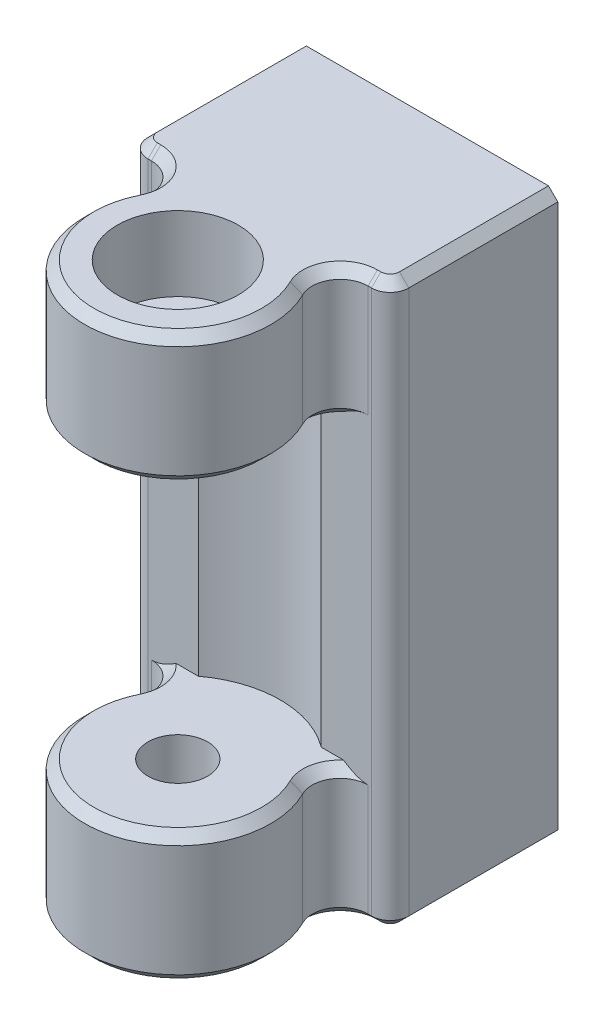
from build123d import *

# Parameters (mm, degrees)
CROQUIS2_R                 = 1.6
SALIENTE_EXTRUIR1_DEPTH    = 15.1
CORTAR_EXTRUIR4_DEPTH      = 8.1
CORTAR_EXTRUIR2_DEPTH      = 37.049965326
CORTAR_EXTRUIR2_DEPTH_BACK = 4
CROQUIS4_R                 = 3.25
CORTAR_EXTRUIR3_DEPTH      = 4
REDONDEO2_R                = 1
CHAFL_N1_SIZE              = 0.5


with BuildPart() as part:
    # Croquis2 → Saliente-Extruir1 (new, symmetric)
    with BuildSketch(Plane(origin=(0, 0, 0), x_dir=(0, 0, -1), z_dir=(0, 1, 0))):
        with BuildLine():
            Line((0, -7), (0, 7))
            Line((0, 7), (-9, 7))
            Line((-9, 7), (-9, 5.817215829))
            ThreePointArc((-9, 5.817215829), (-9.710647783, 4.541706881), (-11.169230769, 4.474781407))
            ThreePointArc((-11.169230769, 4.474781407), (-18.4, 0), (-11.169230769, -4.474781407))
            ThreePointArc((-11.169230769, -4.474781407), (-9.710647783, -4.541706881), (-9, -5.817215829))
            Line((-9, -5.817215829), (-9, -7))
            Line((-9, -7), (0, -7))
        make_face()
        with Locations((-13.4, 0)):
            Circle(CROQUIS2_R, mode=Mode.SUBTRACT)
    extrude(amount=SALIENTE_EXTRUIR1_DEPTH, both=True)

    # Croquis6 → Cortar-Extruir4 (cut, symmetric)
    with BuildSketch(Plane(origin=(0, 0, 0), x_dir=(1, 0, 0), z_dir=(0, 1, 0))):
        with BuildLine():
            Line((-7, -9), (-3.3, -9))
            ThreePointArc((-3.3, -9), (0, -7.9), (3.3, -9))
            Line((3.3, -9), (7, -9))
            Line((7, -9), (7, -18.9))
            Line((7, -18.9), (-7, -18.9))
            Line((-7, -18.9), (-7, -9))
        make_face()
    extrude(amount=CORTAR_EXTRUIR4_DEPTH, both=True, mode=Mode.SUBTRACT)

    # Croquis4 → Cortar-Extruir2 (cut, two sides: drawn at the far end of the back side and taken through both)
    with BuildSketch(Plane(origin=(0, 15.1, 0), x_dir=(1, 0, 0), z_dir=(0, 1, 0)).offset(-CORTAR_EXTRUIR2_DEPTH_BACK)):
        with Locations((0, -13.4)):
            Circle(CROQUIS4_R)
    extrude(amount=CORTAR_EXTRUIR2_DEPTH + CORTAR_EXTRUIR2_DEPTH_BACK, mode=Mode.SUBTRACT)

    # Croquis5 → Cortar-Extruir3 (cut)
    with BuildSketch(Plane.XZ.offset(15.1)):
        Polygon((1.5011107, 10.8), (3.0022214, 13.4), (1.5011107, 16), (-1.5011107, 16), (-3.0022214, 13.4), (-1.5011107, 10.8), align=None)
    extrude(amount=-CORTAR_EXTRUIR3_DEPTH, mode=Mode.SUBTRACT)

    # Redondeo2
    redondeo2_edges = [part.edges().sort_by_distance(p)[0] for p in [
        (-7, 0, 9),
        (7, 0, 9),
    ]]
    fillet(redondeo2_edges, radius=REDONDEO2_R)

    # Chaflán1
    chafl_n1_edges = [part.edges().sort_by_distance(p)[0] for p in [
        (7, -15.1, 4),
        (6.707106781, -15.1, 8.707106781),
        (5.908607914, -15.1, 9),
        (-7, -15.1, 4),
        (4.541706881, -15.1, 9.710647783),
        (-6.707106781, -15.1, 8.707106781),
        (0, -15.1, 18.4),
        (-5.908607914, -15.1, 9),
        (-4.541706881, -15.1, 9.710647783),
    ]]
    chamfer(chafl_n1_edges, length=CHAFL_N1_SIZE)
    chafl_n1_2_edges = [part.edges().sort_by_distance(p)[0] for p in [
        (7, 15.1, 4),
        (6.707106781, 15.1, 8.707106781),
        (5.908607914, 15.1, 9),
        (-7, 15.1, 4),
        (-6.707106781, 15.1, 8.707106781),
        (-5.908607914, 15.1, 9),
        (4.541706881, 15.1, 9.710647783),
        (0, 15.1, 18.4),
        (-4.541706881, 15.1, 9.710647783),
    ]]
    chamfer(chafl_n1_2_edges, length=CHAFL_N1_SIZE)
    chafl_n1_3_edges = [part.edges().sort_by_distance(p)[0] for p in [
        (4.541706881, -8.1, 9.710647783),
        (0, -8.1, 18.4),
        (-4.541706881, -8.1, 9.710647783),
    ]]
    chamfer(chafl_n1_3_edges, length=CHAFL_N1_SIZE)
    chafl_n1_4_edges = [part.edges().sort_by_distance(p)[0] for p in [
        (4.541706881, 8.1, 9.710647783),
        (-4.541706881, 8.1, 9.710647783),
        (0, 8.1, 18.4),
    ]]
    chamfer(chafl_n1_4_edges, length=CHAFL_N1_SIZE)


solid = part.part
